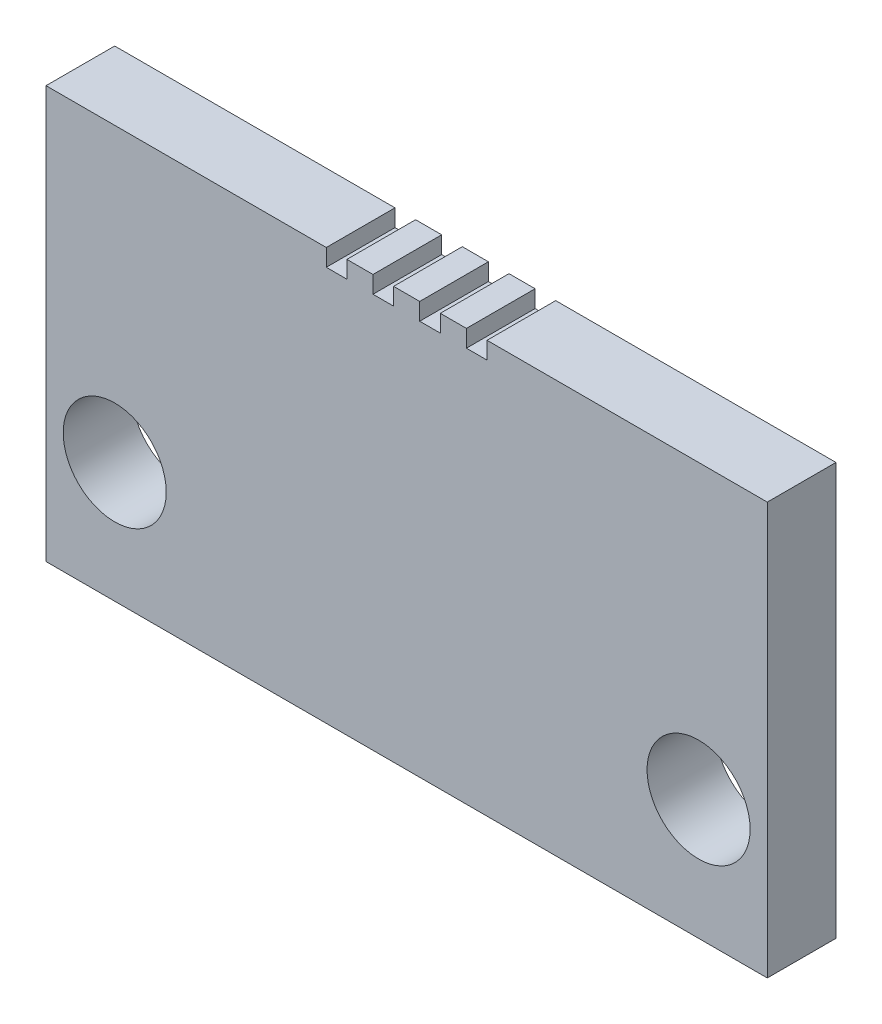
from build123d import *

# Parameters (mm, degrees)
SKETCH1_R           = 1.5
BOSS_EXTRUDE1_DEPTH = 2


with BuildPart() as part:
    # Sketch1 → Boss-Extrude1 (new body)
    with BuildSketch(Plane.XY):
        Polygon((-10.5, -6), (10.5, -6), (10.5, 6), (2.34, 6), (2.34, 5.5), (1.74, 5.5), (1.74, 6), (0.98, 6), (0.98, 5.5), (0.38, 5.5), (0.38, 6), (-0.38, 6), (-0.38, 5.5), (-0.98, 5.5), (-0.98, 6), (-1.74, 6), (-1.74, 5.5), (-2.34, 5.5), (-2.34, 6), (-10.5, 6), align=None)
        with Locations((8.5, -2.5)):
            Circle(SKETCH1_R, mode=Mode.SUBTRACT)
        with Locations((-8.5, -2.5)):
            Circle(SKETCH1_R, mode=Mode.SUBTRACT)
    extrude(amount=BOSS_EXTRUDE1_DEPTH)


solid = part.part
